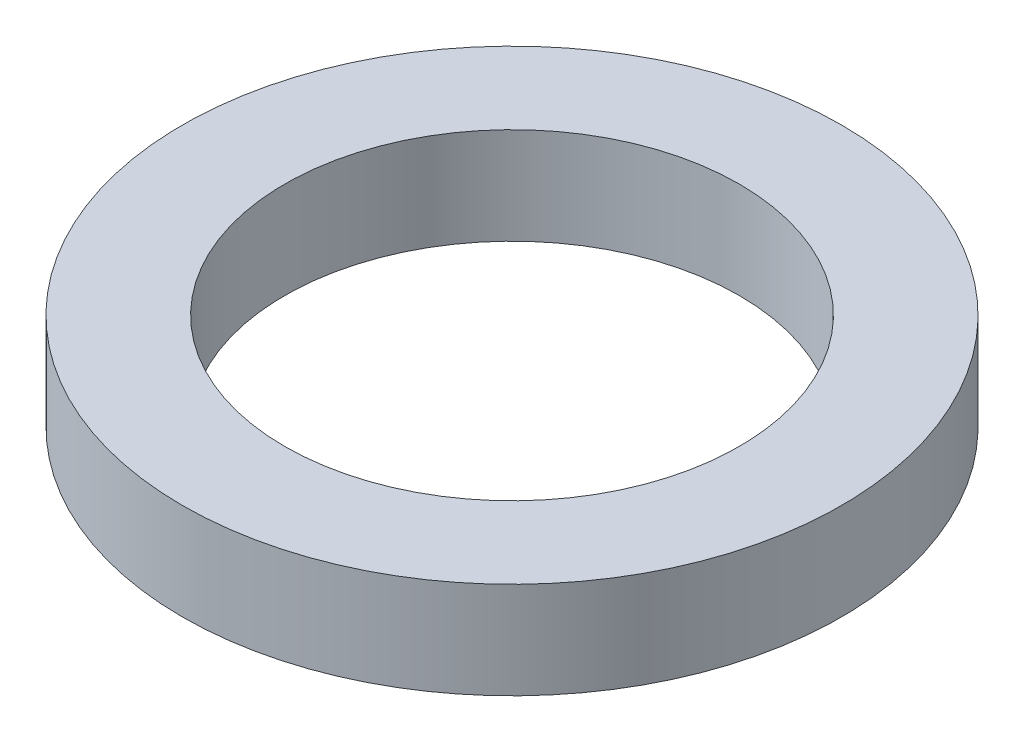
from build123d import *

# Parameters (mm, degrees)
SZKIC1_R                    = 5.8
SZKIC1_R_2                  = 4
DODANIE_WYCI_GNI_CIE1_DEPTH = 1.7


with BuildPart() as part:
    # Szkic1 → Dodanie-wyciągnięcie1 (new body)
    with BuildSketch(Plane(origin=(0, 0, 0), x_dir=(1, 0, 0), z_dir=(0, 1, 0))):
        Circle(SZKIC1_R)
        Circle(SZKIC1_R_2, mode=Mode.SUBTRACT)
    extrude(amount=DODANIE_WYCI_GNI_CIE1_DEPTH)


solid = part.part
